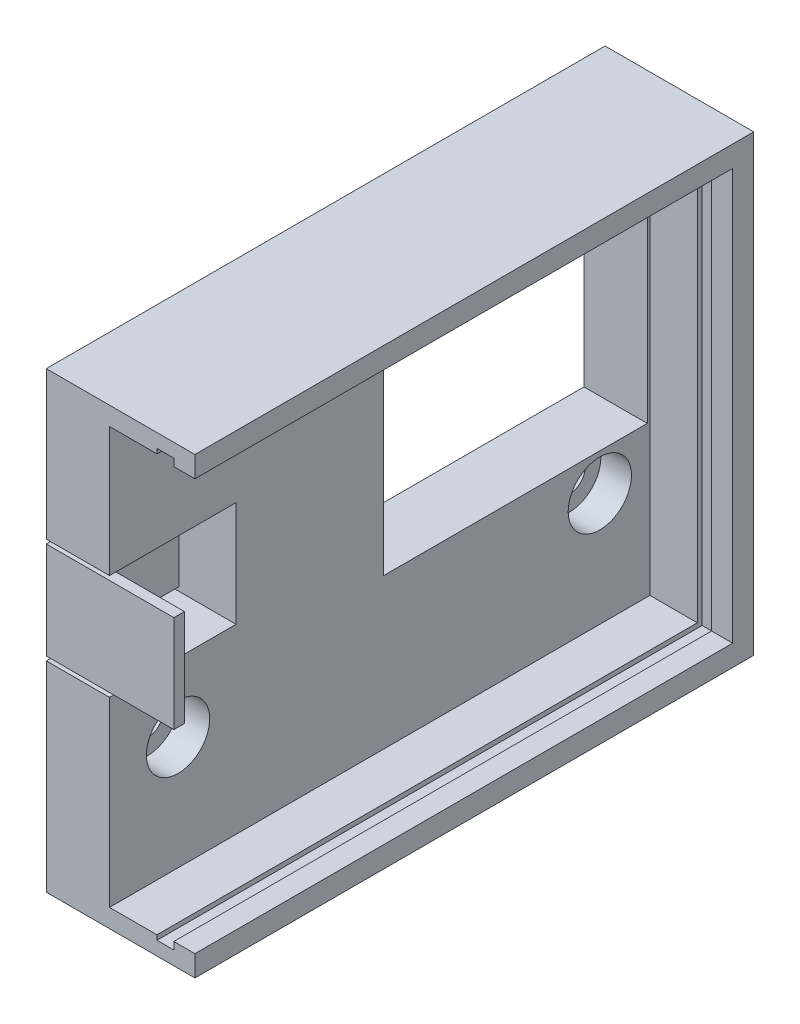
from build123d import *

# Parameters (mm, degrees)
SKETCH1_W           = 43
SKETCH1_H           = 53
SKETCH1_R           = 1.524
BOSS_EXTRUDE1_DEPTH = 6
BOSS_EXTRUDE2_DEPTH = 4.5
BOSS_EXTRUDE3_DEPTH = 1.6
BOSS_EXTRUDE4_DEPTH = 2
SKETCH7_R           = 3
CUT_EXTRUDE2_DEPTH  = 11
SKETCH8_W           = 10
SKETCH8_H           = 12
CUT_EXTRUDE3_DEPTH  = 5.4
SKETCH9_W           = 0.4
SKETCH9_H           = 12
CUT_EXTRUDE4_DEPTH  = 5.5
SKETCH10_W          = 9.2
SKETCH10_H          = 1
BOSS_EXTRUDE5_DEPTH = 11.5
SKETCH11_W          = 25
SKETCH11_H          = 25
CUT_EXTRUDE5_DEPTH  = 11.5


with BuildPart() as part:
    # Sketch1 → Boss-Extrude1 (new body)
    with BuildSketch(Plane.YZ):
        with Locations((-2.736471392, -0.162545389)):
            Rectangle(SKETCH1_W, SKETCH1_H)
        with Locations((-11.736471392, -20.162545389)):
            Circle(SKETCH1_R, mode=Mode.SUBTRACT)
        with Locations((-11.736471392, 19.837454611)):
            Circle(SKETCH1_R, mode=Mode.SUBTRACT)
    extrude(amount=BOSS_EXTRUDE1_DEPTH)

    # Sketch3 → Boss-Extrude2 (add)
    with BuildSketch(Plane.YZ.offset(6)):
        Polygon((-22.486471392, 24.587454611), (-22.486471392, 26.337454611), (-24.236471392, 26.337454611), (-24.236471392, -26.662545389), (18.763528608, -26.662545389), (18.763528608, 26.337454611), (17.013528608, 26.337454611), (17.013528608, 24.587454611), (17.013528608, -24.912545389), (-22.486471392, -24.912545389), align=None)
    extrude(amount=BOSS_EXTRUDE2_DEPTH)

    # Sketch5 → Boss-Extrude3 (add)
    with BuildSketch(Plane.YZ.offset(10.5)):
        Polygon((-22.936471392, 25.037454611), (-22.936471392, 26.337454611), (-24.236471392, 26.337454611), (-24.236471392, -26.662545389), (18.763528608, -26.662545389), (18.763528608, 26.337454611), (17.463528608, 26.337454611), (17.463528608, 25.037454611), (17.463528608, -25.362545389), (-22.936471392, -25.362545389), align=None)
    extrude(amount=BOSS_EXTRUDE3_DEPTH)

    # Sketch6 → Boss-Extrude4 (add)
    with BuildSketch(Plane.YZ.offset(12.1)):
        Polygon((-22.236471392, 24.337454611), (-22.236471392, 26.337454611), (-24.236471392, 26.337454611), (-24.236471392, -26.662545389), (18.763528608, -26.662545389), (18.763528608, 26.337454611), (16.763528608, 26.337454611), (16.763528608, 24.337454611), (16.763528608, -24.662545389), (-22.236471392, -24.662545389), align=None)
    extrude(amount=BOSS_EXTRUDE4_DEPTH)

    # Sketch7 → Cut-Extrude2 (cut)
    with BuildSketch(Plane.YZ.offset(14.1)):
        with Locations((-11.736471392, -20.162545389)):
            Circle(SKETCH7_R)
        with Locations((-11.736471392, 19.837454611)):
            Circle(SKETCH7_R)
    extrude(amount=-CUT_EXTRUDE2_DEPTH, mode=Mode.SUBTRACT)

    # Sketch8 → Cut-Extrude3 (cut)
    with BuildSketch(Plane.YZ.offset(6)):
        with Locations((-0.236471392, 20.337454611)):
            Rectangle(SKETCH8_W, SKETCH8_H)
    extrude(amount=-CUT_EXTRUDE3_DEPTH, mode=Mode.SUBTRACT)

    # Sketch9 → Cut-Extrude4 (cut)
    with BuildSketch(Plane.YZ.offset(0.6)):
        with Locations((-5.036471392, 20.337454611)):
            Rectangle(SKETCH9_W, SKETCH9_H)
        with Locations((4.563528608, 20.337454611)):
            Rectangle(SKETCH9_W, SKETCH9_H)
    extrude(amount=-CUT_EXTRUDE4_DEPTH, mode=Mode.SUBTRACT)

    # Sketch10 → Boss-Extrude5 (add)
    with BuildSketch(Plane.YZ.offset(0.6)):
        with Locations((-0.236471392, 25.837454611)):
            Rectangle(SKETCH10_W, SKETCH10_H)
    extrude(amount=BOSS_EXTRUDE5_DEPTH)

    # Sketch11 → Cut-Extrude5 (cut)
    with BuildSketch(Plane.YZ.offset(6)):
        with Locations((4.263528608, -12.162545389)):
            Rectangle(SKETCH11_W, SKETCH11_H)
    extrude(amount=-CUT_EXTRUDE5_DEPTH, mode=Mode.SUBTRACT)


solid = part.part
